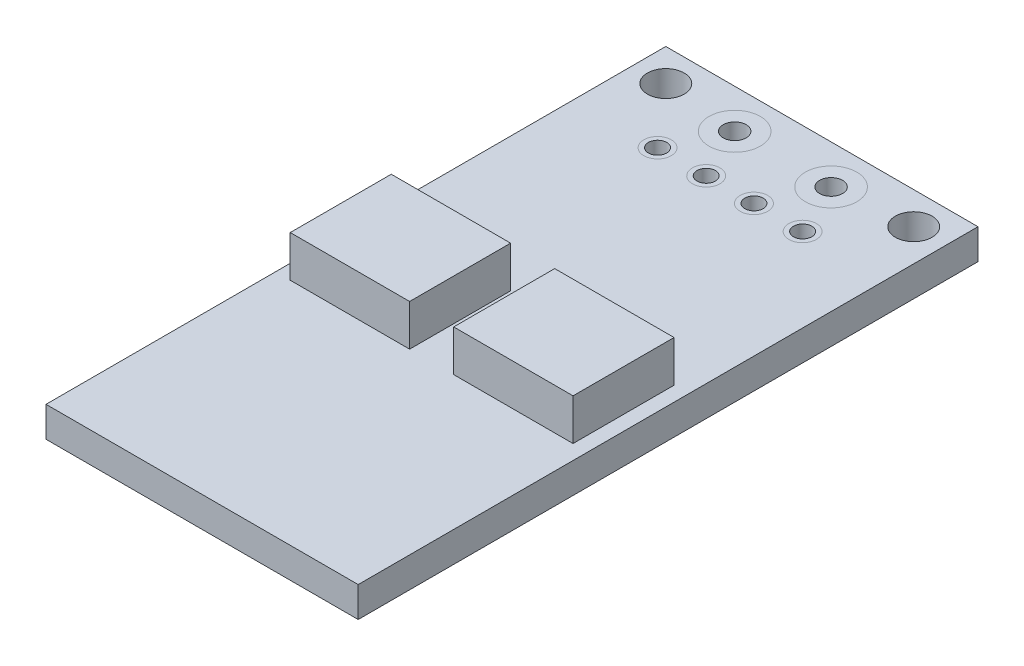
from build123d import *

# Parameters (mm, degrees)
PCB_SKETCH_W                     = 17
PCB_SKETCH_H                     = 33.75
PCB_EXTRUDE_DEPTH                = 1.65
THROUGH_HOLE_SKETCH_R            = 1.4
THROUGH_HOLE_SKETCH_R_2          = 0.625
THROUGH_HOLE_SKETCH_R_3          = 0.75
THROUGH_HOLE_SKETCH_R_4          = 0.5
THROUGH_HOLE_CUT_DEPTH           = 19.966763693
MOUNTING_HOLES_SKETCH_R          = 1
MOUNTING_HOLE_CUT_DEPTH          = 1.65
HOLES_MIRROR_OUTLINE_R           = 1.4
HOLES_MIRROR_OUTLINE_R_2         = 0.75
HOLES_MIRROR_OUTLINE_R_3         = 1
HOLES_MIRROR_DEPTH               = 1.65
THROUGH_HOLE_EXTRUDE_OUTLINE_R   = 0.75
THROUGH_HOLE_EXTRUDE_OUTLINE_R_2 = 0.5
THROUGH_HOLE_EXTRUDE_OUTLINE_R_3 = 1.4
THROUGH_HOLE_EXTRUDE_OUTLINE_R_4 = 0.625
THROUGH_HOLE_EXTRUDE_DEPTH       = 1.65
MOSFET_SKETCH_W                  = 6.5
MOSFET_SKETCH_H                  = 5.5
MOSFET_EXTRUDE_DEPTH             = 2.25


# Read off the part's stored shape, not the designer's step: Holes Mirror, Through Hole Extrude
with BuildPart() as part:
    # PCB Sketch → PCB Extrude (new body)
    with BuildSketch(Plane(origin=(0, 0, 0), x_dir=(1, 0, 0), z_dir=(0, 1, 0))):
        Rectangle(PCB_SKETCH_W, PCB_SKETCH_H)
    extrude(amount=PCB_EXTRUDE_DEPTH)

    # Through Hole Sketch → Through Hole Cut (cut, through all)
    # profile 1 of 4: a face of its own
    with BuildSketch(Plane(origin=(0, 1.65, 0), x_dir=(1, 0, 0), z_dir=(0, 1, 0))):
        with Locations(Location((-2.625, 14.75, 0), (0, 0, 270))):
            Circle(THROUGH_HOLE_SKETCH_R)
        with Locations((-2.625, 14.75)):
            Circle(THROUGH_HOLE_SKETCH_R_2, mode=Mode.SUBTRACT)
    # profile 2 of 4: a face of its own
    with BuildSketch(Plane(origin=(0, 1.65, 0), x_dir=(1, 0, 0), z_dir=(0, 1, 0))):
        with Locations((-2.625, 14.75)):
            Circle(THROUGH_HOLE_SKETCH_R_2)
    # profile 3 of 4: a face of its own
    with BuildSketch(Plane(origin=(0, 1.65, 0), x_dir=(1, 0, 0), z_dir=(0, 1, 0))):
        with Locations(Location((-1.3, 11.875, 0), (0, 0, 270))):
            Circle(THROUGH_HOLE_SKETCH_R_3)
        with Locations((-1.3, 11.875)):
            Circle(THROUGH_HOLE_SKETCH_R_4, mode=Mode.SUBTRACT)
    # profile 4 of 4: a face of its own
    with BuildSketch(Plane(origin=(0, 1.65, 0), x_dir=(1, 0, 0), z_dir=(0, 1, 0))):
        with Locations(Location((-3.95, 11.875, 0), (0, 0, 270))):
            Circle(THROUGH_HOLE_SKETCH_R_3)
    extrude(amount=-THROUGH_HOLE_CUT_DEPTH, mode=Mode.SUBTRACT)


with BuildPart() as through_hole_cut_kept_piece:
    # of the separate pieces the step leaves, the one the design keeps (through_hole_cut_pieces_kept)
    add(part.part.solids().sort_by_distance((-8.5, 0, 16.875))[0])

    # Mounting Holes Sketch → Mounting Hole Cut (cut)
    with BuildSketch(Plane(origin=(0, 1.65, 0), x_dir=(1, 0, 0), z_dir=(0, 1, 0))):
        with Locations(Location((-6.75, 15.125, 0), (0, 0, 270))):
            Circle(MOUNTING_HOLES_SKETCH_R)
    extrude(amount=-MOUNTING_HOLE_CUT_DEPTH, mode=Mode.SUBTRACT)

    # Holes Mirror outline → Holes Mirror (cut)
    with BuildSketch(Plane(origin=(0, 0, 0), x_dir=(1, 0, 0), z_dir=(0, 1, 0))):
        with Locations((2.625, 14.75)):
            Circle(HOLES_MIRROR_OUTLINE_R)
        with Locations((1.3, 11.875)):
            Circle(HOLES_MIRROR_OUTLINE_R_2)
        with Locations((3.95, 11.875)):
            Circle(HOLES_MIRROR_OUTLINE_R_2)
        with Locations((6.75, 15.125)):
            Circle(HOLES_MIRROR_OUTLINE_R_3)
    extrude(amount=HOLES_MIRROR_DEPTH, mode=Mode.SUBTRACT)


with BuildPart() as body_2:
    # Through Hole Extrude outline → Through Hole Extrude (new body)
    # profile 1 of 3: a face of its own
    with BuildSketch(Plane(origin=(0, 0, 0), x_dir=(1, 0, 0), z_dir=(0, 1, 0))):
        with Locations((-3.95, 11.875)):
            Circle(THROUGH_HOLE_EXTRUDE_OUTLINE_R)
        with Locations((-3.95, 11.875)):
            Circle(THROUGH_HOLE_EXTRUDE_OUTLINE_R_2, mode=Mode.SUBTRACT)
    # profile 2 of 3: a face of its own
    with BuildSketch(Plane(origin=(0, 0, 0), x_dir=(1, 0, 0), z_dir=(0, 1, 0))):
        with Locations((-1.3, 11.875)):
            Circle(THROUGH_HOLE_EXTRUDE_OUTLINE_R)
        with Locations((-1.3, 11.875)):
            Circle(THROUGH_HOLE_EXTRUDE_OUTLINE_R_2, mode=Mode.SUBTRACT)
    # profile 3 of 3: a face of its own
    with BuildSketch(Plane(origin=(0, 0, 0), x_dir=(1, 0, 0), z_dir=(0, 1, 0))):
        with Locations((-2.625, 14.75)):
            Circle(THROUGH_HOLE_EXTRUDE_OUTLINE_R_3)
        with Locations((-2.625, 14.75)):
            Circle(THROUGH_HOLE_EXTRUDE_OUTLINE_R_4, mode=Mode.SUBTRACT)
    extrude(amount=THROUGH_HOLE_EXTRUDE_DEPTH)


with BuildPart() as body_3:
    # Mosfet Sketch → Mosfet Extrude (new body)
    with BuildSketch(Plane(origin=(0, 1.65, 0), x_dir=(1, 0, 0), z_dir=(0, 1, 0))):
        with Locations((-4.45, -1.625)):
            Rectangle(MOSFET_SKETCH_W, MOSFET_SKETCH_H)
    extrude(amount=MOSFET_EXTRUDE_DEPTH)


with BuildPart() as body_4:
    # Bodies Mirror: mirrored copy
    add(body_2.part.mirror(Plane(origin=(0, 0, 0), x_dir=(0, 0, 1), z_dir=(1, 0, 0))))


with BuildPart() as body_5:
    # Bodies Mirror 2: mirrored copy
    add(body_3.part.mirror(Plane(origin=(0, 0, 0), x_dir=(0, 0, 1), z_dir=(1, 0, 0))))


solid = Compound([through_hole_cut_kept_piece.part, body_2.part, body_3.part, body_4.part, body_5.part])
